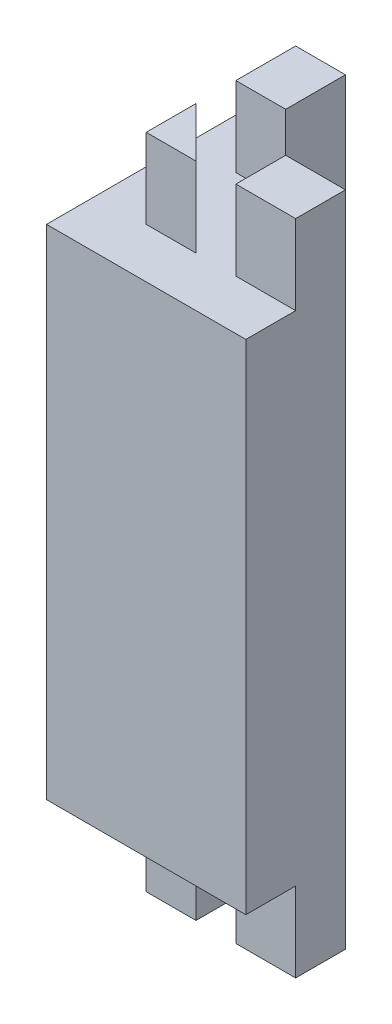
from build123d import *

# Parameters (mm, degrees)
BOSS_EXTRUDE2_DEPTH = 25
SKETCH13_W          = 2.5
SKETCH13_H          = 3
SKETCH13_W_2        = 3
SKETCH13_H_2        = 2.5
BOSS_EXTRUDE3_DEPTH = 4
SKETCH15_W          = 2.5
SKETCH15_H          = 3
SKETCH15_W_2        = 3
SKETCH15_H_2        = 2.5
BOSS_EXTRUDE4_DEPTH = 4


with BuildPart() as part:
    # Sketch12 → Boss-Extrude2 (new body)
    with BuildSketch(Plane(origin=(0, 0, 0), x_dir=(1, 0, 0), z_dir=(0, 1, 0))):
        Polygon((-5, -5), (5, -5), (5, 0), (0, 0), (0, 5), (-5, 5), (-5, 0), align=None)
    extrude(amount=BOSS_EXTRUDE2_DEPTH)

    # Sketch13 → Boss-Extrude3 (add)
    with BuildSketch(Plane(origin=(0, 0, 0), x_dir=(1, 0, 0), z_dir=(0, 1, 0))):
        with Locations((-1.25, 3.5)):
            Rectangle(SKETCH13_W, SKETCH13_H)
        with Locations((3.5, -1.25)):
            Rectangle(SKETCH13_W_2, SKETCH13_H_2)
        with Locations((-1.25, -1.25)):
            Rectangle(SKETCH13_W, SKETCH13_H_2)
    extrude(amount=-BOSS_EXTRUDE3_DEPTH)

    # Sketch15 → Boss-Extrude4 (add)
    with BuildSketch(Plane(origin=(0, 25, 0), x_dir=(1, 0, 0), z_dir=(0, 1, 0))):
        with Locations((-1.25, 3.5)):
            Rectangle(SKETCH15_W, SKETCH15_H)
        with Locations((3.5, -1.25)):
            Rectangle(SKETCH15_W_2, SKETCH15_H_2)
        Polygon((0, -2.5), (-2.5, -2.5), (-2.5, 0), align=None)
    extrude(amount=BOSS_EXTRUDE4_DEPTH)


solid = part.part
